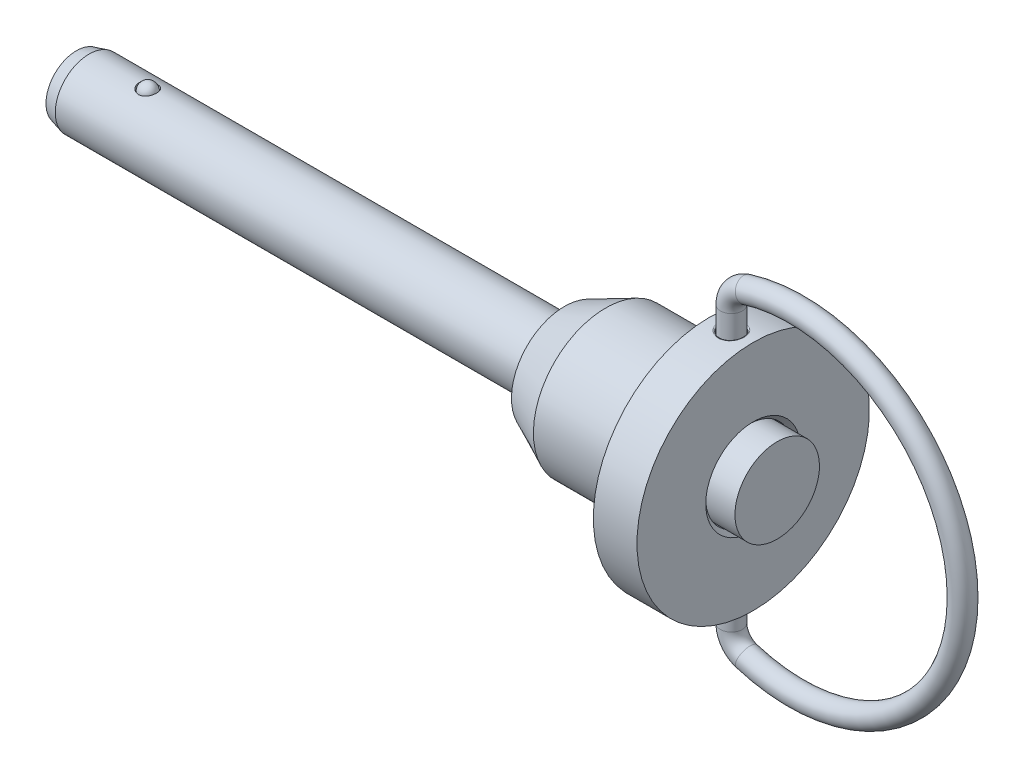
from build123d import *

# Parameters (mm, degrees)
CUT_REVOLVE_THIN1_START         = -32.639
CUT_REVOLVE_THIN1_OUTLINE_R     = 2.212848
CUT_REVOLVE_THIN1_OUTLINE_R_2   = 2.136648
CUT_REVOLVE_THIN1_DEPTH         = 54.139079867
CUT_REVOLVE_THIN1_START_2       = 21.423879867
CUT_REVOLVE_THIN1_2_OUTLINE_R   = 4.0132
CUT_REVOLVE_THIN1_2_OUTLINE_R_2 = 3.937
CUT_REVOLVE_THIN1_2_DEPTH       = 8.979920133
CUT_REVOLVE_THIN1_3_OUTLINE_R   = 3.937
CUT_REVOLVE_THIN1_3_OUTLINE_R_2 = 2.212848
CUT_REVOLVE_THIN1_3_DEPTH       = 0.0762
CHAMFER1_SIZE                   = 0.4064
CUT_REVOLVE1_START              = -32.639
CUT_REVOLVE1_OUTLINE_R          = 2.136648
CUT_REVOLVE1_DEPTH              = 4.910666667
SKETCH6_W                       = 1.0795
SKETCH6_H                       = 3.445197891
FILLET1_R                       = 0.127
FILLET1_OF_MIRROR3_R            = 0.127
SKETCH8_R                       = 1.016
FILLET3_R                       = 0.9906


# Read off the part's stored shape, not the designer's step: Cut-Revolve-Thin1, Cut-Revolve1
with BuildPart() as part:
    # Sketch1 → Revolve1 (revolve)
    with BuildSketch(Plane.XY, mode=Mode.PRIVATE) as revolve1_sk:
        Polygon((32.639, 3.937), (30.4038, 3.937), (30.4038, 10.827395781), (29.3878, 10.827395781), (27.3558, 10.827395781), (26.3398, 10.827395781), (26.3398, 6.731), (16.660359733, 6.731), (12.827, 4.943475), (12.827, 3.15595), (-31.461183425, 3.15595), (-32.639, 2.840355), (-32.639, 0), (32.639, 0), align=None)
    revolve(revolve1_sk.sketch.rotate(Axis((32.639, 0, 0), (1, 0, 0)), 180), axis=Axis((32.639, 0, 0), (1, 0, 0)))

    # Cut-Revolve-Thin1 outline → Cut-Revolve-Thin1 (cut)
    with BuildSketch(Plane.YZ.offset(CUT_REVOLVE_THIN1_START)):
        Circle(CUT_REVOLVE_THIN1_OUTLINE_R)
        Circle(CUT_REVOLVE_THIN1_OUTLINE_R_2, mode=Mode.SUBTRACT)
    extrude(amount=CUT_REVOLVE_THIN1_DEPTH, mode=Mode.SUBTRACT)

    # Cut-Revolve-Thin1 2 outline → Cut-Revolve-Thin1 2 (cut)
    with BuildSketch(Plane.YZ.offset(CUT_REVOLVE_THIN1_START_2)):
        Circle(CUT_REVOLVE_THIN1_2_OUTLINE_R)
        Circle(CUT_REVOLVE_THIN1_2_OUTLINE_R_2, mode=Mode.SUBTRACT)
    extrude(amount=CUT_REVOLVE_THIN1_2_DEPTH, mode=Mode.SUBTRACT)

    # Cut-Revolve-Thin1 3 outline → Cut-Revolve-Thin1 3 (cut)
    with BuildSketch(Plane.YZ.offset(CUT_REVOLVE_THIN1_START_2)):
        Circle(CUT_REVOLVE_THIN1_3_OUTLINE_R)
        Circle(CUT_REVOLVE_THIN1_3_OUTLINE_R_2, mode=Mode.SUBTRACT)
    extrude(amount=CUT_REVOLVE_THIN1_3_DEPTH, mode=Mode.SUBTRACT)

    # Chamfer1
    chamfer1_edges = [part.edges().sort_by_distance(p)[0] for p in [
        (30.4038, -4.0132, 0),
    ]]
    chamfer(chamfer1_edges, length=CHAMFER1_SIZE)

    # Cut-Revolve1 outline → Cut-Revolve1 (cut)
    with BuildSketch(Plane.YZ.offset(CUT_REVOLVE1_START)):
        Circle(CUT_REVOLVE1_OUTLINE_R)
    extrude(amount=CUT_REVOLVE1_DEPTH, mode=Mode.SUBTRACT)

    # Sketch4 → Cut-Revolve2 (revolve, cut)
    with BuildSketch(Plane.XY):
        with BuildLine():
            Line((-25.128644427, 2.903474), (-26.865496427, 2.903474))
            ThreePointArc((-26.865496427, 2.903474), (-25.997070427, 3.7719), (-25.128644427, 2.903474))
        make_face()
    cut_revolve2 = revolve(axis=Axis((-25.128644427, 2.903474, 0), (1, 0, 0)), mode=Mode.SUBTRACT)

    # Mirror1: Cut-Revolve2 across plane
    add(cut_revolve2.mirror(Plane.ZX), mode=Mode.SUBTRACT)

    # Sketch6 → Cut-Revolve3 (revolve, cut)
    with BuildSketch(Plane.XY, mode=Mode.PRIVATE) as cut_revolve3_sk:
        with Locations((27.83205, 9.104796836)):
            Rectangle(SKETCH6_W, SKETCH6_H)
    cut_revolve3 = revolve(cut_revolve3_sk.sketch.rotate(Axis((28.3718, 7.38219789, 0), (0, -1, 0)), 270), axis=Axis((28.3718, 7.38219789, 0), (0, -1, 0)), mode=Mode.SUBTRACT)

    # Fillet1
    fillet1_edges = [part.edges().sort_by_distance(p)[0] for p in [
        (28.3718, 10.773447876, -1.0795),
    ]]
    fillet(fillet1_edges, radius=FILLET1_R)

    # Mirror3: Cut-Revolve3 across plane
    add(cut_revolve3.mirror(Plane.ZX), mode=Mode.SUBTRACT)

    # Fillet1 of Mirror3
    fillet1_of_mirror3_edges = [part.edges().sort_by_distance(p)[0] for p in [
        (28.3718, -10.773447876, -1.0795),
    ]]
    fillet(fillet1_of_mirror3_edges, radius=FILLET1_OF_MIRROR3_R)


with BuildPart() as body_2:
    # Sketch5 → Revolve2 (revolve)
    with BuildSketch(Plane.XY):
        with BuildLine():
            Line((-25.230244427, 2.903474), (-26.763896427, 2.903474))
            ThreePointArc((-26.763896427, 2.903474), (-25.997070427, 3.6703), (-25.230244427, 2.903474))
        make_face()
    revolve(axis=Axis((-25.230244427, 2.903474, 0), (1, 0, 0)))


with BuildPart() as body_3:
    # Mirror2: mirrored copy
    add(body_2.part.mirror(Plane.ZX))


with BuildPart() as body_4:
    # Sweep1: sweep along a path in Sketch7
    with BuildLine(Plane.XY) as sweep1_path:
        Line((27.3558, -7.382470992), (27.3558, -12.849889873))
        ThreePointArc((27.3558, -12.849889873), (27.948207778, -14.655539573), (29.495150943, -15.759298901))
        ThreePointArc((29.495150943, -15.759298901), (50.927, 0), (29.495150943, 15.759298901))
        ThreePointArc((29.495150943, 15.759298901), (27.948207778, 14.655539573), (27.3558, 12.849889873))
        Line((27.3558, 12.849889873), (27.3558, 7.38219789))
    # Sketch8 → Sweep1 (sweep)
    with BuildSketch(Plane(origin=(0, 7.38219789, 0), x_dir=(-1, 0, 0), z_dir=(0, 1, 0))):
        with Locations((-28.3718, 0)):
            Circle(SKETCH8_R)
    sweep(path=sweep1_path.line)

    # Fillet3
    fillet3_edges = [body_4.edges().sort_by_distance(p)[0] for p in [
        (29.3878, 7.38219789, 0),
        (29.3878, -7.382470992, 0),
    ]]
    fillet(fillet3_edges, radius=FILLET3_R)


solid = Compound([part.part, body_2.part, body_3.part, body_4.part])
